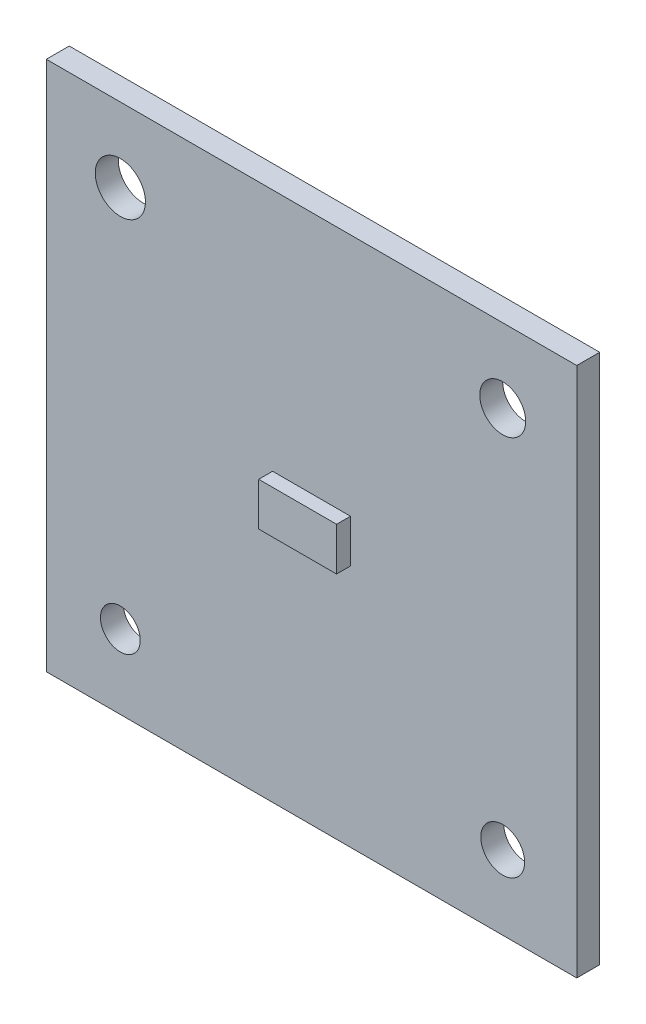
from build123d import *

# Parameters (mm, degrees)
SKIZZE1_W                       = 38.15
SKIZZE1_H                       = 38.15
SKIZZE1_R                       = 1.803576344
SKIZZE1_R_2                     = 1.651884651
SKIZZE1_R_3                     = 1.577721115
SKIZZE1_R_4                     = 1.431155303
AUFSATZ_LINEAR_AUSTRAGEN1_DEPTH = 1.65
SKIZZE2_W                       = 5.6
SKIZZE2_H                       = 3.1
AUFSATZ_LINEAR_AUSTRAGEN2_DEPTH = 1


with BuildPart() as part:
    # Skizze1 → Aufsatz-Linear austragen1 (new body)
    with BuildSketch(Plane.XY):
        Rectangle(SKIZZE1_W, SKIZZE1_H)
        with Locations((-13.75, 13.75)):
            Circle(SKIZZE1_R, mode=Mode.SUBTRACT)
        with Locations((13.75, 13.75)):
            Circle(SKIZZE1_R_2, mode=Mode.SUBTRACT)
        with Locations((13.75, -13.75)):
            Circle(SKIZZE1_R_3, mode=Mode.SUBTRACT)
        with Locations((-13.75, -13.75)):
            Circle(SKIZZE1_R_4, mode=Mode.SUBTRACT)
    extrude(amount=AUFSATZ_LINEAR_AUSTRAGEN1_DEPTH)

    # Skizze2 → Aufsatz-Linear austragen2 (add)
    with BuildSketch(Plane.XY.offset(1.65)):
        Rectangle(SKIZZE2_W, SKIZZE2_H)
    extrude(amount=AUFSATZ_LINEAR_AUSTRAGEN2_DEPTH)


solid = part.part
